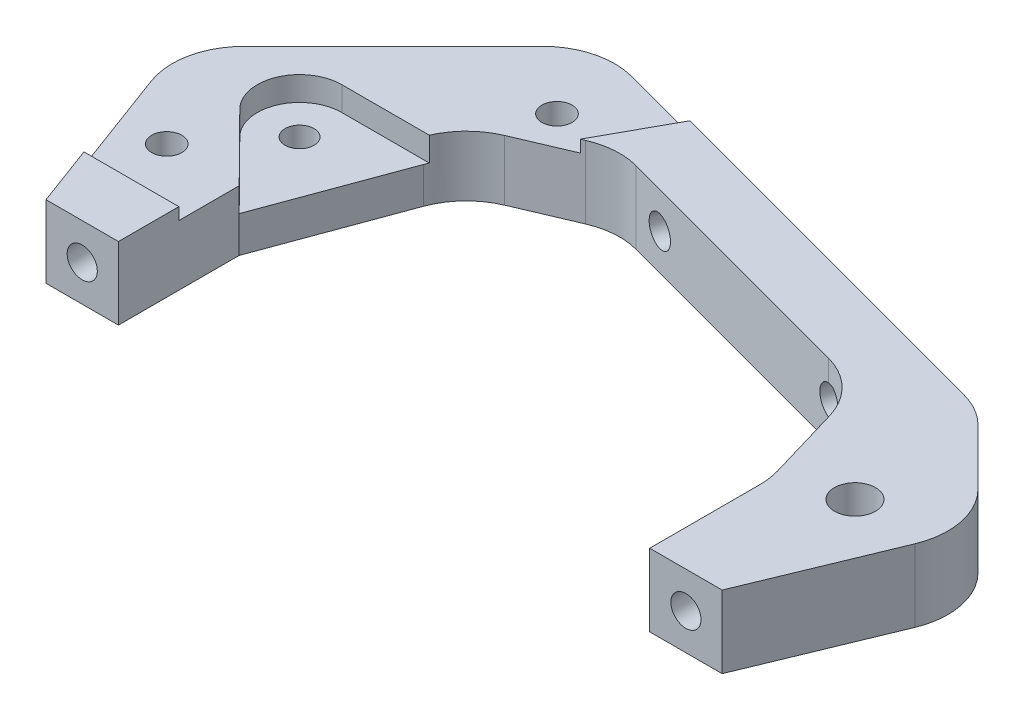
from build123d import *

# Parameters (mm, degrees)
AUFSATZ_LINEAR_AUSTRAGEN1_DEPTH  = 6
VERRUNDUNG1_R                    = 6
DURCHGANGSLOCH_F_R_M21_OUTLINE_R = 1.2
DURCHGANGSLOCH_F_R_M21_DEPTH     = 6
SCHNITT_LINEAR_AUSTRAGEN1_DEPTH  = 3
SCHNITT_LINEAR_AUSTRAGEN2_DEPTH  = 1
M3_GEWINDEBOHRUNG2_D             = 2.5
M3_GEWINDEBOHRUNG3_D             = 2.5
M3_GEWINDEBOHRUNG3_DEPTH         = 6.5
M3_GEWINDEBOHRUNG3_TIP           = 0.751075774
M3_GEWINDEBOHRUNG4_D             = 2.5
M3_GEWINDEBOHRUNG4_DEPTH         = 6.5
M3_GEWINDEBOHRUNG4_TIP           = 0.751075774
DURCHGANGSLOCH_F_R_M32_OUTLINE_R = 1.7
DURCHGANGSLOCH_F_R_M32_DEPTH     = 6


# Read off the part's stored shape, not the designer's step: Durchgangsloch für M21, M3 Gewindebohrung1, Durchgangsloch für M32
with BuildPart() as part:
    # Skizze1 → Aufsatz-Linear austragen1 (new body)
    with BuildSketch(Plane(origin=(0, 0, 0), x_dir=(1, 0, 0), z_dir=(0, 1, 0))):
        Polygon((-6, 0), (0, 0), (0, 10), (5, 23.583657959), (14, 27.412076366), (41, 20.17744817), (44, 10), (44, 0), (50, 0), (56.190026492, 15), (47.606368533, 23.583657959), (5, 35), (-12.5, 17.5), align=None)
    extrude(amount=AUFSATZ_LINEAR_AUSTRAGEN1_DEPTH)

    # Verrundung1
    verrundung1_edges = [part.edges().sort_by_distance(p)[0] for p in [
        (-12.5, 3, -17.5),
        (5, 3, -35),
        (47.606368533, 3, -23.583657959),
        (56.190026492, 3, -15),
        (44, 3, -10),
        (41, 3, -20.17744817),
        (14, 3, -27.412076366),
        (5, 3, -23.583657959),
    ]]
    fillet(verrundung1_edges, radius=VERRUNDUNG1_R)

    # Durchgangsloch für M21 outline → Durchgangsloch für M21 (cut)
    with BuildSketch(Plane(origin=(0, 0, 0), x_dir=(1, 0, 0), z_dir=(0, 1, 0))):
        with Locations((-3, 18)):
            Circle(DURCHGANGSLOCH_F_R_M21_OUTLINE_R)
    extrude(amount=DURCHGANGSLOCH_F_R_M21_DEPTH, mode=Mode.SUBTRACT)

    # M3 Gewindebohrung1 outline → M3 Gewindebohrung1 (revolve, cut)
    with BuildSketch(Plane(origin=(47, 3, 0), x_dir=(1, 0, 0), z_dir=(0, -1, 0))):
        Polygon((0, 0), (0, -7.251075774), (1.25, -6.5), (1.25, 0), align=None)
    revolve(axis=Axis((47, 3, 0), (0, 0, 1)), mode=Mode.SUBTRACT)

    # M3 Gewindebohrung1 2 outline → M3 Gewindebohrung1 2 (revolve, cut)
    with BuildSketch(Plane(origin=(-3, 3, 0), x_dir=(1, 0, 0), z_dir=(0, -1, 0))):
        Polygon((0, 0), (0, -7.251075774), (1.25, -6.5), (1.25, 0), align=None)
    revolve(axis=Axis((-3, 3, 0), (0, 0, 1)), mode=Mode.SUBTRACT)

    # Skizze8 → Schnitt-Linear austragen1 (cut)
    with BuildSketch(Plane(origin=(0, 6, 0), x_dir=(1, 0, 0), z_dir=(0, 1, 0))):
        with BuildLine():
            Line((-5.48614249, 15.536446566), (0, 10))
            Line((0, 10), (4.293633921, 21.5))
            Line((4.293633921, 21.5), (-3, 21.5))
            ThreePointArc((-3, 21.5), (-6.23051366, 19.346767052), (-5.48614249, 15.536446566))
        make_face()
    extrude(amount=-SCHNITT_LINEAR_AUSTRAGEN1_DEPTH, mode=Mode.SUBTRACT)

    # Skizze9 → Schnitt-Linear austragen2 (cut)
    with BuildSketch(Plane(origin=(0, 6, 0), x_dir=(1, 0, 0), z_dir=(0, 1, 0))):
        Polygon((-7.857142857, 5), (0, 5), (15, 32.320508076), (5, 35), (-12.5, 17.5), align=None)
    extrude(amount=-SCHNITT_LINEAR_AUSTRAGEN2_DEPTH, mode=Mode.SUBTRACT)

    # M3 Gewindebohrung2 (through all)
    with Locations(Plane(origin=(0, 5, 0), x_dir=(1, 0, 0), z_dir=(0, 1, 0))):
        with Locations((8, 28.320508076), (-6, 10)):
            Hole(M3_GEWINDEBOHRUNG2_D / 2)

    # M3 Gewindebohrung3
    with Locations(Plane(origin=(9.084936491, 0, -33.905444566), x_dir=(-0.9659258262890604, 0, -0.2588190451025504), z_dir=(0.2588190451025504, 0, -0.9659258262890604))):
        with Locations((-31.272625875, 3), (-11.272625875, 3)):
            Hole(M3_GEWINDEBOHRUNG3_D / 2, depth=M3_GEWINDEBOHRUNG3_DEPTH)
            with Locations((0, 0, -(M3_GEWINDEBOHRUNG3_DEPTH + M3_GEWINDEBOHRUNG3_TIP / 2))):  # 118° drill point
                Cone(0, M3_GEWINDEBOHRUNG3_D / 2, M3_GEWINDEBOHRUNG3_TIP, mode=Mode.SUBTRACT)

    # M3 Gewindebohrung4
    with Locations(Plane(origin=(35.595013246, 0, -35.595013246), x_dir=(-0.7071067811865515, 0, -0.7071067811865436), z_dir=(0.7071067811865436, 0, -0.7071067811865515))):
        with Locations((-21.594316704, 3)):
            Hole(M3_GEWINDEBOHRUNG4_D / 2, depth=M3_GEWINDEBOHRUNG4_DEPTH)
            with Locations((0, 0, -(M3_GEWINDEBOHRUNG4_DEPTH + M3_GEWINDEBOHRUNG4_TIP / 2))):  # 118° drill point
                Cone(0, M3_GEWINDEBOHRUNG4_D / 2, M3_GEWINDEBOHRUNG4_TIP, mode=Mode.SUBTRACT)

    # Durchgangsloch für M32 outline → Durchgangsloch für M32 (cut)
    with BuildSketch(Plane(origin=(0, 0, 0), x_dir=(1, 0, 0), z_dir=(0, 1, 0))):
        with Locations((49, 12)):
            Circle(DURCHGANGSLOCH_F_R_M32_OUTLINE_R)
    extrude(amount=DURCHGANGSLOCH_F_R_M32_DEPTH, mode=Mode.SUBTRACT)


solid = part.part
